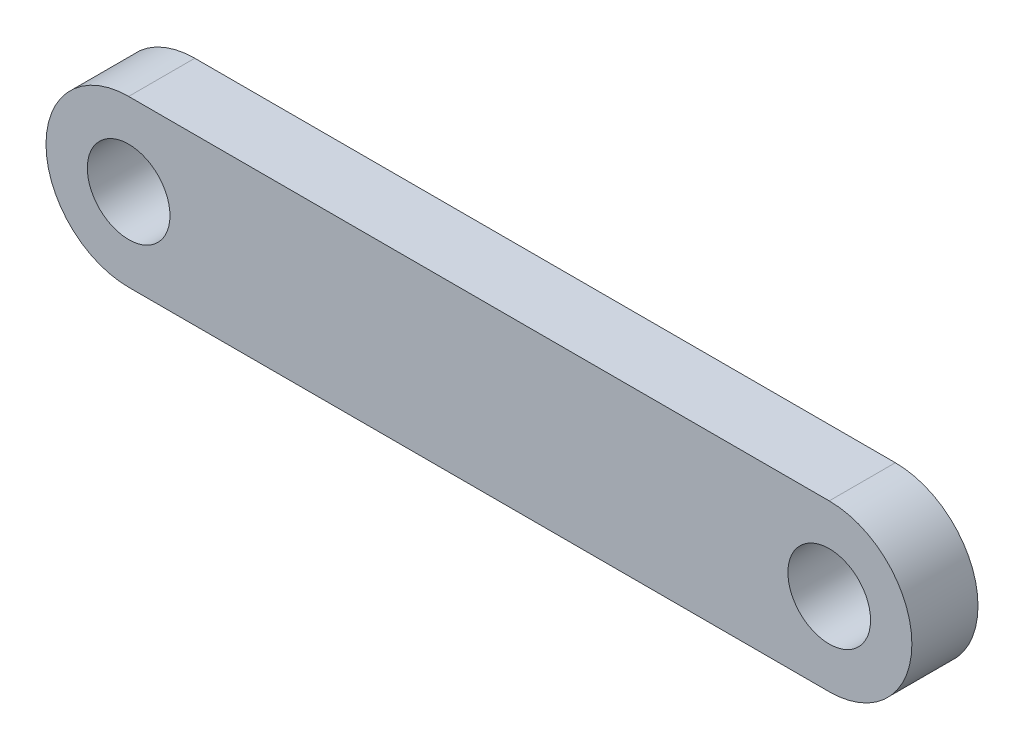
from build123d import *

# Parameters (mm, degrees)
SKETCH1_R           = 1.5875
BOSS_EXTRUDE2_DEPTH = 2.54


with BuildPart() as part:
    # Sketch1 → Boss-Extrude2 (new body)
    with BuildSketch(Plane.XY):
        with BuildLine():
            Line((26.91066051, 3.175), (0, 3.175))
            ThreePointArc((0, 3.175), (-3.175, 0), (0, -3.175))
            Line((0, -3.175), (26.91066051, -3.175))
            ThreePointArc((26.91066051, -3.175), (30.08566051, 0), (26.91066051, 3.175))
        make_face()
        with Locations((26.91066051, 0)):
            Circle(SKETCH1_R, mode=Mode.SUBTRACT)
        Circle(SKETCH1_R, mode=Mode.SUBTRACT)
    extrude(amount=BOSS_EXTRUDE2_DEPTH)


solid = part.part
